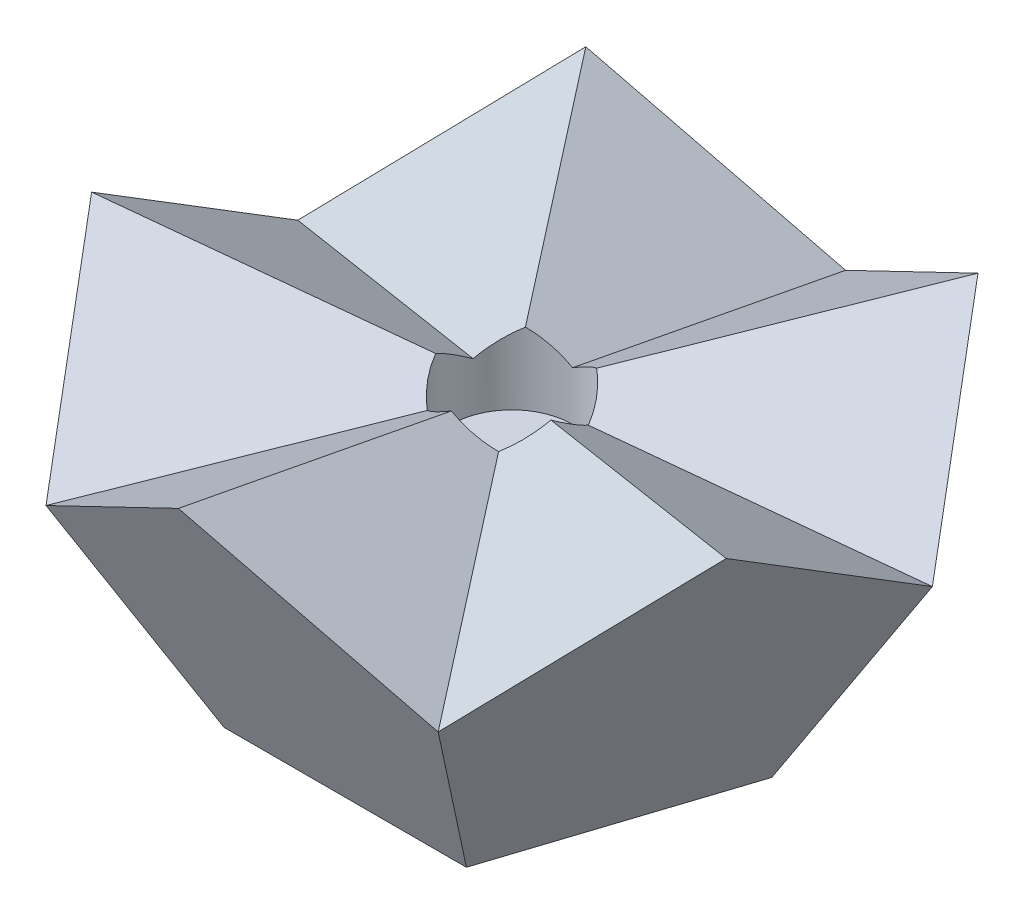
from build123d import *

# Parameters (mm, degrees)
BOSS_EXTRUDE1_DEPTH     = 12.7
BOSS_EXTRUDE1_TAPER     = 31.717474411
CUT_EXTRUDE1_DEPTH      = 3.175
CUT_EXTRUDE1_DEPTH_BACK = 30.300987171
SKETCH4_R               = 3.175


with BuildPart() as part:
    # Sketch2 → Boss-Extrude1 (new body)
    with BuildSketch(Plane(origin=(0, 0, 0), x_dir=(1, 0, 0), z_dir=(0, 1, 0))):
        Polygon((0, 10.803265266), (-10.274515829, 3.338392562), (-6.35, -8.740025195), (6.35, -8.740025195), (10.274515829, 3.338392562), align=None)
    boss_extrude1 = extrude(amount=BOSS_EXTRUDE1_DEPTH, taper=BOSS_EXTRUDE1_TAPER)

    # Mirror1: Boss-Extrude1 across plane
    add(boss_extrude1.mirror(Plane(origin=(10.274515829, 0, -3.338392562), x_dir=(0.47426800993097906, 0.49867489660708536, 0.7255296012224597), z_dir=(0.4999999999999995, 0.5257311121191347, -0.6881909602355865))))

    # Mirror3: Boss-Extrude1 across plane
    add(boss_extrude1.mirror(Plane(origin=(-10.274515829, 0, -3.338392562), x_dir=(0.22041412184245507, -0.14323377902898698, 0.964832472213438), z_dir=(-0.8090169943749469, 0.5257311121191346, 0.26286555605956685))))

    # Mirror4: Boss-Extrude1 across plane
    add(boss_extrude1.mirror(Plane(origin=(0, 0, -10.803265266), x_dir=(-0.47426800993097906, 0.49867489660708486, 0.72552960122246), z_dir=(-0.49999999999999994, 0.5257311121191346, -0.6881909602355861))))

    # Mirror5: Boss-Extrude1 across plane
    add(boss_extrude1.mirror(Plane(origin=(-6.35, 0, 8.740025195), x_dir=(0, -0.8506508083520393, 0.5257311121191345), z_dir=(0, 0.5257311121191347, 0.8506508083520393))))

    # Mirror6: Boss-Extrude1 across plane
    add(boss_extrude1.mirror(Plane(origin=(6.35, 0, 8.740025195), x_dir=(-0.22041412184245487, -0.14323377902898687, 0.9648324722134382), z_dir=(0.8090169943749469, 0.5257311121191347, 0.26286555605956663))))

    # Sketch4 → Cut-Extrude1 (cut, two sides: drawn at the far end of the back side and taken through both)
    with BuildSketch(Plane(origin=(0.523712861, 14.141657828, -1.611822452), x_dir=(-1, 0, 0), z_dir=(0, -1, 0)).offset(-CUT_EXTRUDE1_DEPTH_BACK)):
        with Locations((0.523712861, -1.611822452)):
            Circle(SKETCH4_R)
    extrude(amount=CUT_EXTRUDE1_DEPTH + CUT_EXTRUDE1_DEPTH_BACK, mode=Mode.SUBTRACT)


solid = part.part
